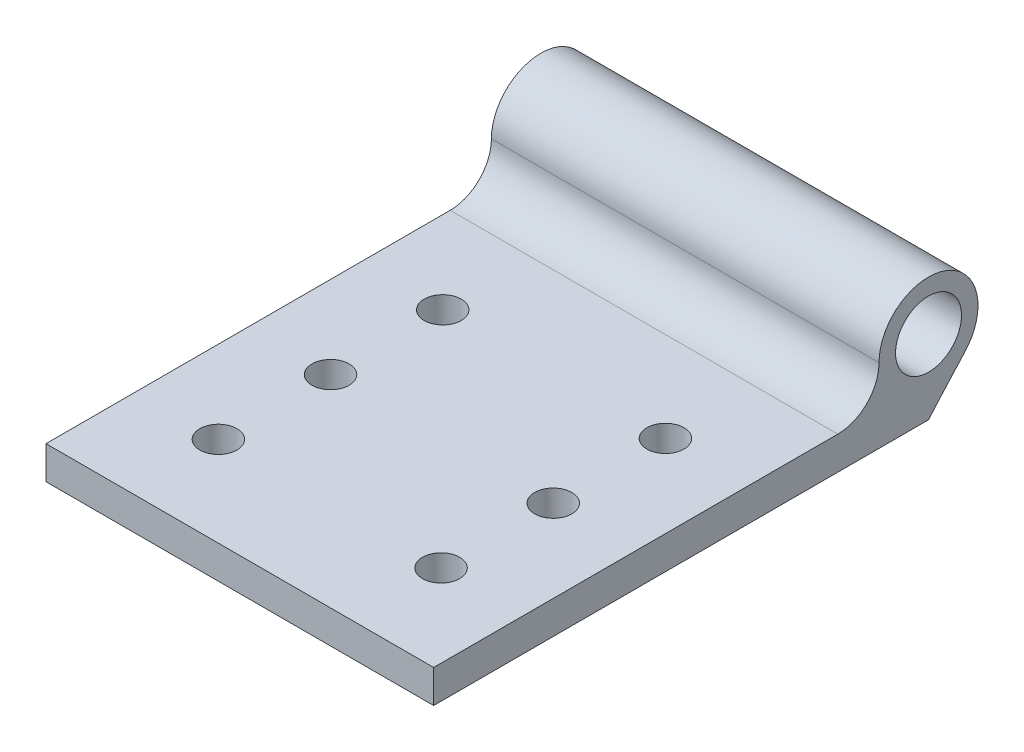
from build123d import *

# Parameters (mm, degrees)
SKETCH1_W           = 23.5
SKETCH1_H           = 2
BOSS_EXTRUDE1_DEPTH = 30
SKETCH2_R           = 3
SKETCH2_R_2         = 2
BOSS_EXTRUDE2_DEPTH = 23.5
FILLET1_R           = 110
FILLET2_R           = 2.5
SKETCH3_R           = 1.125
CUT_EXTRUDE1_DEPTH  = 24


with BuildPart() as part:
    # Sketch1 → Boss-Extrude1 (new body)
    with BuildSketch(Plane.XY):
        with Locations((0, 1)):
            Rectangle(SKETCH1_W, SKETCH1_H)
    extrude(amount=BOSS_EXTRUDE1_DEPTH)

    # Sketch2 → Boss-Extrude2 (add)
    with BuildSketch(Plane(origin=(11.75, 0, 0), x_dir=(0, 0, -1), z_dir=(1, 0, 0))):
        with Locations((0, 4.5)):
            Circle(SKETCH2_R)
        with Locations(Location((0, 4.5, 0), (0, 0, 90))):
            Circle(SKETCH2_R_2, mode=Mode.SUBTRACT)
    extrude(amount=-BOSS_EXTRUDE2_DEPTH)

    # Fillet1
    # the kernel refuses this fillet: 110 mm, written as the material it adds along each edge
    with BuildSketch(Plane(origin=(-11.75, 1.5, 0), x_dir=(0, -1, 0), z_dir=(1, 0, 0))) as fillet1_piece_1:
        with BuildLine():
            CenterArc((73.583333333, 83.090270523), FILLET1_R, 227.333597139, 1.723771549)
            ThreePointArc((-0.966814159, 2.205936386), (-0.252313926, 1.204251319), (0, 0))
            Line((0, 0), (1.5, 0))
        make_face()
    extrude(amount=23.5)

    # Fillet2
    fillet2_edges = [part.edges().sort_by_distance(p)[0] for p in [
        (0, 2, 1.658312395),
    ]]
    fillet(fillet2_edges, radius=FILLET2_R)

    # Sketch3 → Cut-Extrude1 (cut)
    with BuildSketch(Plane(origin=(0, 2, 0), x_dir=(1, 0, 0), z_dir=(0, 1, 0))):
        with Locations(Location((-6.75, -10.95, 0), (0, 0, 180))):
            Circle(SKETCH3_R)
        with Locations(Location((-6.75, -17.75, 0), (0, 0, 180))):
            Circle(SKETCH3_R)
        with Locations(Location((-6.75, -24.55, 0), (0, 0, 180))):
            Circle(SKETCH3_R)
        with Locations(Location((6.75, -24.55, 0), (0, 0, 180))):
            Circle(SKETCH3_R)
        with Locations(Location((6.75, -17.75, 0), (0, 0, 180))):
            Circle(SKETCH3_R)
        with Locations(Location((6.75, -10.95, 0), (0, 0, 180))):
            Circle(SKETCH3_R)
    extrude(amount=-CUT_EXTRUDE1_DEPTH, mode=Mode.SUBTRACT)


solid = part.part
